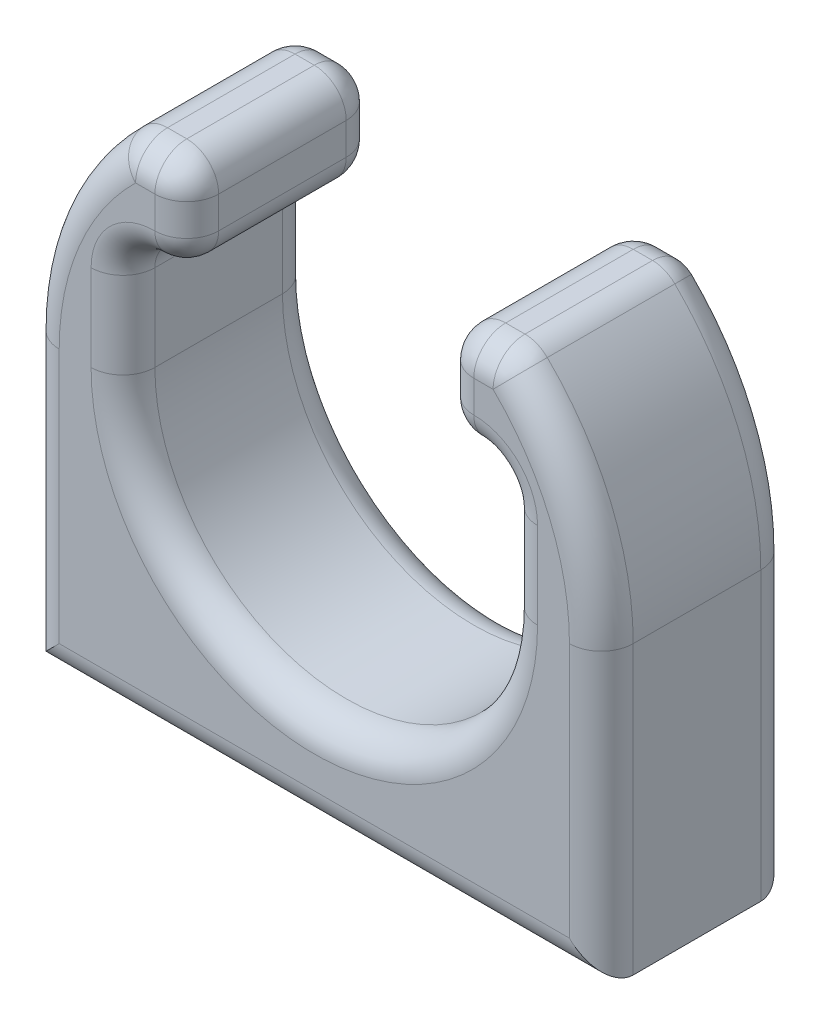
from build123d import *

# Parameters (mm, degrees)
EXTRUDE_1_DEPTH = 3
FILLET_1_R      = 0.5


with BuildPart() as part:
    # Эскиз1 → Бобышка-Вытянуть1 (new body)
    with BuildSketch(Plane.XY):
        with BuildLine():
            Line((-3, 0), (-3, 1.854101966))
            Line((-3, 1.854101966), (-2, 1.854101966))
            Line((-2, 1.854101966), (-2, 3.354101966))
            Line((-2, 3.354101966), (-3, 3.354101966))
            ThreePointArc((-3, 3.354101966), (-4.107919181, 1.837117307), (-4.5, 0))
            Line((-4.5, 0), (-4.5, -4.5))
            Line((-4.5, -4.5), (4.5, -4.5))
            Line((4.5, -4.5), (4.5, 0))
            ThreePointArc((4.5, 0), (4.107919181, 1.837117307), (3, 3.354101966))
            Line((3, 3.354101966), (2, 3.354101966))
            Line((2, 3.354101966), (2, 1.854101966))
            Line((2, 1.854101966), (3, 1.854101966))
            Line((3, 1.854101966), (3, 0))
            ThreePointArc((3, 0), (0, -3), (-3, 0))
        make_face()
    extrude(amount=EXTRUDE_1_DEPTH)

    # Скругление1
    fillet_1_edges = [part.edges().sort_by_distance(p)[0] for p in [
        (3, 1.854101966, 1.5),
        (-3, 1.854101966, 1.5),
    ]]
    fillet(fillet_1_edges, radius=FILLET_1_R)
    fillet_1_2_edges = [part.edges().sort_by_distance(p)[0] for p in [
        (3, 3.354101966, 1.5),
        (-4.5, -2.25, 0),
        (0, -4.5, 0),
        (4.5, -2.25, 0),
        (4.107919181, 1.837117307, 0),
        (2.5, 3.354101966, 0),
        (0, -3, 0),
        (-3, 0.677050983, 0),
        (-2, 2.604101966, 0),
        (-2.5, 3.354101966, 0),
        (-4.107919181, 1.837117307, 0),
        (3, 0.677050983, 0),
        (-2.5, 3.354101966, 3),
        (-2, 2.604101966, 3),
        (-3, 0.677050983, 3),
        (0, -3, 3),
        (3, 0.677050983, 3),
        (2.5, 3.354101966, 3),
        (4.107919181, 1.837117307, 3),
        (4.5, -2.25, 3),
        (0, -4.5, 3),
        (-4.5, -2.25, 3),
        (-4.107919181, 1.837117307, 3),
        (2, 3.354101966, 1.5),
        (2, 2.604101966, 3),
        (2, 1.854101966, 1.5),
        (2, 2.604101966, 0),
        (-3, 3.354101966, 1.5),
        (-2, 3.354101966, 1.5),
        (-2, 1.854101966, 1.5),
        (2.853553391, 1.707655357, 3),
        (-2.853553391, 1.707655357, 3),
        (2.853553391, 1.707655357, 0),
        (-2.853553391, 1.707655357, 0),
    ]]
    fillet(fillet_1_2_edges, radius=FILLET_1_R - 0.0001)  # a hair under: the kernel refuses the full size


solid = part.part
